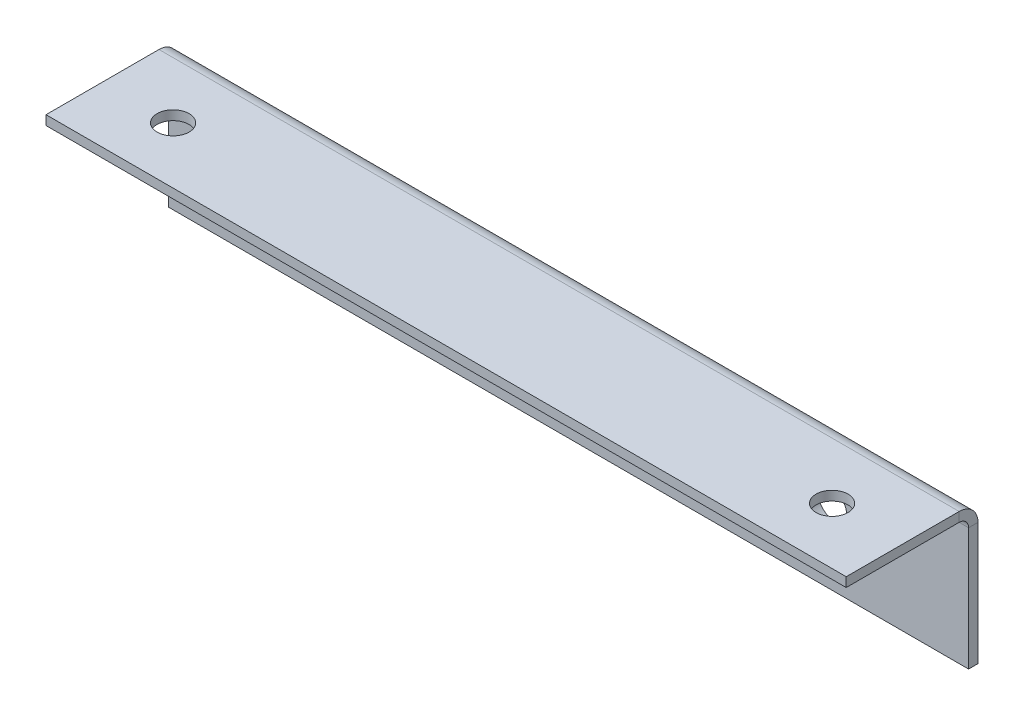
from build123d import *

# Parameters (mm, degrees)
SKETCH_1_W                       = 85
SKETCH_1_H                       = 15
SM_BASE_FLANGE_1_DEPTH           = 1
SM_EDGE_FLANGE_1_STRIP_W         = 6
SM_EDGE_FLANGE_1_STRIP_H         = 1
SM_EDGE_FLANGE_1_STRIP_CUT_DEPTH = 85
SM_EDGE_FLANGE_1_DEPTH           = 85
SKETCH_9_R                       = 2.1
CUT_EXTRUDE_1_DEPTH              = 10
HOLE_WIZARD_M31_D                = 3.4
HOLE_WIZARD_M31_DEPTH            = 18.5
HOLE_WIZARD_M31_TIP              = 1.021463052


# Sheet-metal steps are written as plain solids
with BuildPart() as part:
    # Sketch 1 → Базовая кромка1 (new body)
    with BuildSketch(Plane.XY):
        Rectangle(SKETCH_1_W, SKETCH_1_H)
    extrude(amount=-SM_BASE_FLANGE_1_DEPTH)

    # Ребро-кромка1 strip (across the edge) → Ребро-кромка1 strip cut (cut)
    with BuildSketch(Plane(origin=(42.5, 7.5, 0), x_dir=(0, -1, 0), z_dir=(-1, 0, 0))):
        with Locations((-1, -0.5)):
            Rectangle(SM_EDGE_FLANGE_1_STRIP_W, SM_EDGE_FLANGE_1_STRIP_H)
    extrude(amount=SM_EDGE_FLANGE_1_STRIP_CUT_DEPTH, mode=Mode.SUBTRACT)

    # Ребро-кромка1 section (across the edge) → Ребро-кромка1 (add)
    with BuildSketch(Plane(origin=(42.5, 7.5, 0), x_dir=(0, -1, 0), z_dir=(-1, 0, 0))):
        with BuildLine():
            Line((0, 1), (0, 13))
            Line((0, 13), (1, 13))
            Line((1, 13), (1, 1))
            ThreePointArc((1, 1), (1.292893219, 0.292893219), (2, 0))
            Line((2, 0), (2, -1))
            ThreePointArc((2, -1), (0.585786438, -0.414213562), (0, 1))
        make_face()
    extrude(amount=SM_EDGE_FLANGE_1_DEPTH)

    # Эскиз9 → Вырез-Вытянуть1 (cut)
    with BuildSketch(Plane.XY):
        with Locations((-27.5, 0)):
            Circle(SKETCH_9_R)
        with Locations((27.5, 0)):
            Circle(SKETCH_9_R)
    extrude(amount=-CUT_EXTRUDE_1_DEPTH, mode=Mode.SUBTRACT)

    # Отверстие с зазором M31
    with Locations(Plane(origin=(0, 6.5, 0), x_dir=(-1, 0, 0), z_dir=(0, -1, 0))):
        with Locations((-35, -7), (35, -7)):
            Hole(HOLE_WIZARD_M31_D / 2, depth=HOLE_WIZARD_M31_DEPTH)
            with Locations((0, 0, -(HOLE_WIZARD_M31_DEPTH + HOLE_WIZARD_M31_TIP / 2))):  # 118° drill point
                Cone(0, HOLE_WIZARD_M31_D / 2, HOLE_WIZARD_M31_TIP, mode=Mode.SUBTRACT)


solid = part.part
